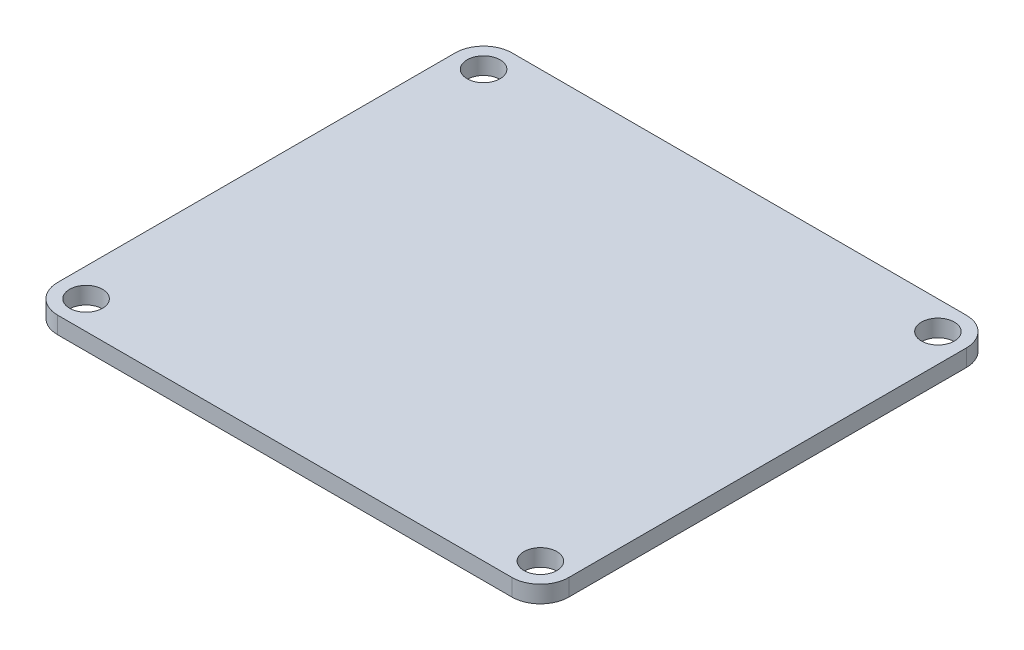
from build123d import *

# Parameters (mm, degrees)
SKETCH1_W             = 45.72
SKETCH1_H             = 40.64
BOSS_EXTRUDE1_DEPTH   = 0.762
FILLET1_R             = 2.54
F_4_CLEARANCE_HOLE1_D = 2.9464


with BuildPart() as part:
    # Sketch1 → Boss-Extrude1 (new, symmetric)
    with BuildSketch(Plane(origin=(0, 0, 0), x_dir=(1, 0, 0), z_dir=(0, 1, 0))):
        Rectangle(SKETCH1_W, SKETCH1_H)
    extrude(amount=BOSS_EXTRUDE1_DEPTH, both=True)

    # Fillet1
    fillet1_edges = [part.edges().sort_by_distance(p)[0] for p in [
        (22.86, 0, -20.32),
        (-22.86, 0, -20.32),
        (22.86, 0, 20.32),
        (-22.86, 0, 20.32),
    ]]
    fillet(fillet1_edges, radius=FILLET1_R)

    # #4 Clearance Hole1 (through all)
    with Locations(Plane(origin=(0, 0.762, 0), x_dir=(1, 0, 0), z_dir=(0, 1, 0))):
        with Locations((20.32, 17.78), (-20.32, -17.78), (-20.32, 17.78), (20.32, -17.78)):
            Hole(F_4_CLEARANCE_HOLE1_D / 2)


solid = part.part
